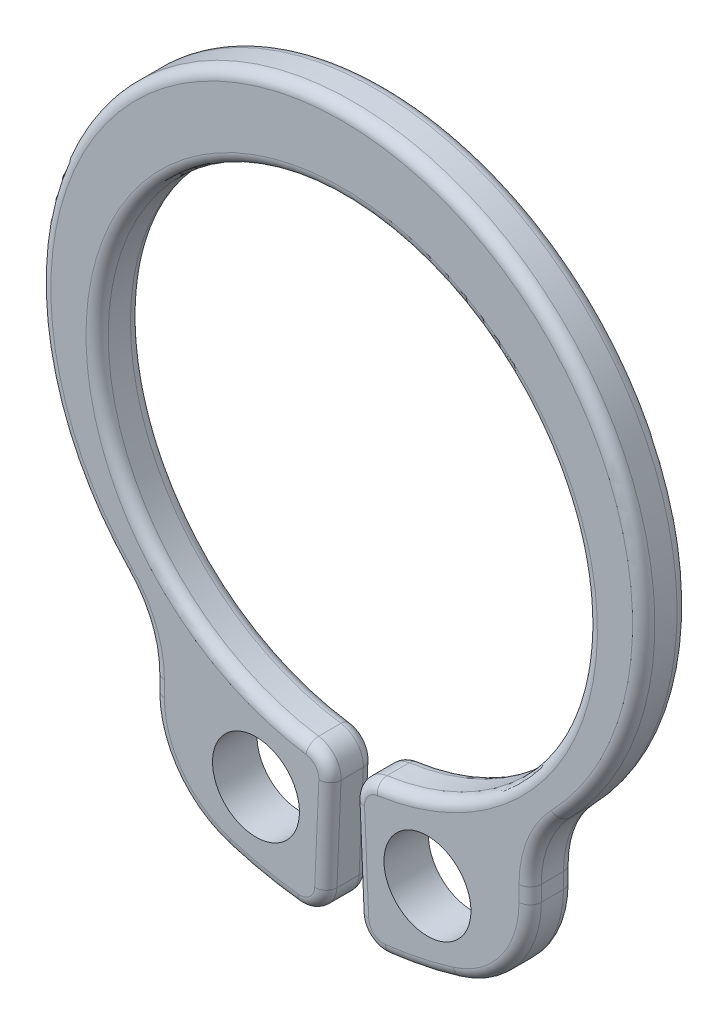
from build123d import *

# Parameters (mm, degrees)
SKETCH2_R           = 0.9775
BOSS_EXTRUDE1_DEPTH = 0.5
FILLET1_R           = 2.345231598
FILLET2_R           = 0.586307899
FILLET3_R           = 0.25


with BuildPart() as part:
    # Sketch2 → Boss-Extrude1 (new, symmetric)
    with BuildSketch(Plane.XY):
        with BuildLine():
            Line((-4.238441776, -7.721608218), (-4.235611145, -4.797874345))
            ThreePointArc((-4.235611145, -4.797874345), (-6.4089579, 2.753446809), (0, 7.3))
            Line((0, 7.3), (0, 5.5))
            ThreePointArc((0, 5.5), (-5.498691149, 0.119981868), (-0.239906631, -5.494765219))
            Line((-0.239906631, -5.494765219), (-0.384216298, -8.8))
            ThreePointArc((-0.384216298, -8.8), (-2.373388743, -8.482608563), (-4.238441776, -7.721608218))
        make_face()
        with Locations((-1.927672435, -6.889596469)):
            Circle(SKETCH2_R, mode=Mode.SUBTRACT)
    extrude(amount=BOSS_EXTRUDE1_DEPTH, both=True)

    # Fillet1
    fillet1_edges = [part.edges().sort_by_distance(p)[0] for p in [
        (-4.235611145, -4.797874345, 0),
        (-4.238441776, -7.721608218, 0),
    ]]
    fillet(fillet1_edges, radius=FILLET1_R)

    # Fillet2
    fillet2_edges = [part.edges().sort_by_distance(p)[0] for p in [
        (-0.384216298, -8.8, 0),
        (-0.239906631, -5.494765219, 0),
    ]]
    fillet(fillet2_edges, radius=FILLET2_R)

    # Mirror1: part across plane


with BuildPart() as part_1:
    add(part.part)
    add(part.part.mirror(Plane(origin=(0, 7.3, 0.5), x_dir=(0, 0, 1), z_dir=(-1, 0, 0))))

    # Fillet3
    fillet3_edges = [part_1.edges().sort_by_distance(p)[0] for p in [
        (-0.399126544, -5.651863663, -0.5),
        (-0.310987617, -7.122787459, -0.5),
        (-0.563049305, -8.61389272, -0.5),
        (-1.801911763, -8.622107408, -0.5),
        (-3.777856114, -7.573876592, -0.5),
        (-4.236777929, -6.003035614, -0.5),
        (-4.406247452, -4.950227612, -0.5),
        (6.248463616, 3.167848868, -0.5),
        (4.406247452, -4.950227612, -0.5),
        (4.236777929, -6.003035614, -0.5),
        (3.777856114, -7.573876592, -0.5),
        (1.801911763, -8.622107408, -0.5),
        (0.563049305, -8.61389272, -0.5),
        (0.310987617, -7.122787459, -0.5),
        (0.399126544, -5.651863663, -0.5),
        (-0.399126544, -5.651863663, 0.5),
        (-0.310987617, -7.122787459, 0.5),
        (-0.563049305, -8.61389272, 0.5),
        (-1.801911763, -8.622107408, 0.5),
        (-3.777856114, -7.573876592, 0.5),
        (-4.236777929, -6.003035614, 0.5),
        (-4.406247452, -4.950227612, 0.5),
        (6.248463616, 3.167848868, 0.5),
        (4.406247452, -4.950227612, 0.5),
        (4.236777929, -6.003035614, 0.5),
        (3.777856114, -7.573876592, 0.5),
        (1.801911763, -8.622107408, 0.5),
        (0.563049305, -8.61389272, 0.5),
        (0.310987617, -7.122787459, 0.5),
        (0.399126544, -5.651863663, 0.5),
        (0, 5.5, -0.5),
        (5.486508349, 0.385001482, 0.5),
    ]]
    fillet(fillet3_edges, radius=FILLET3_R)


solid = part_1.part
